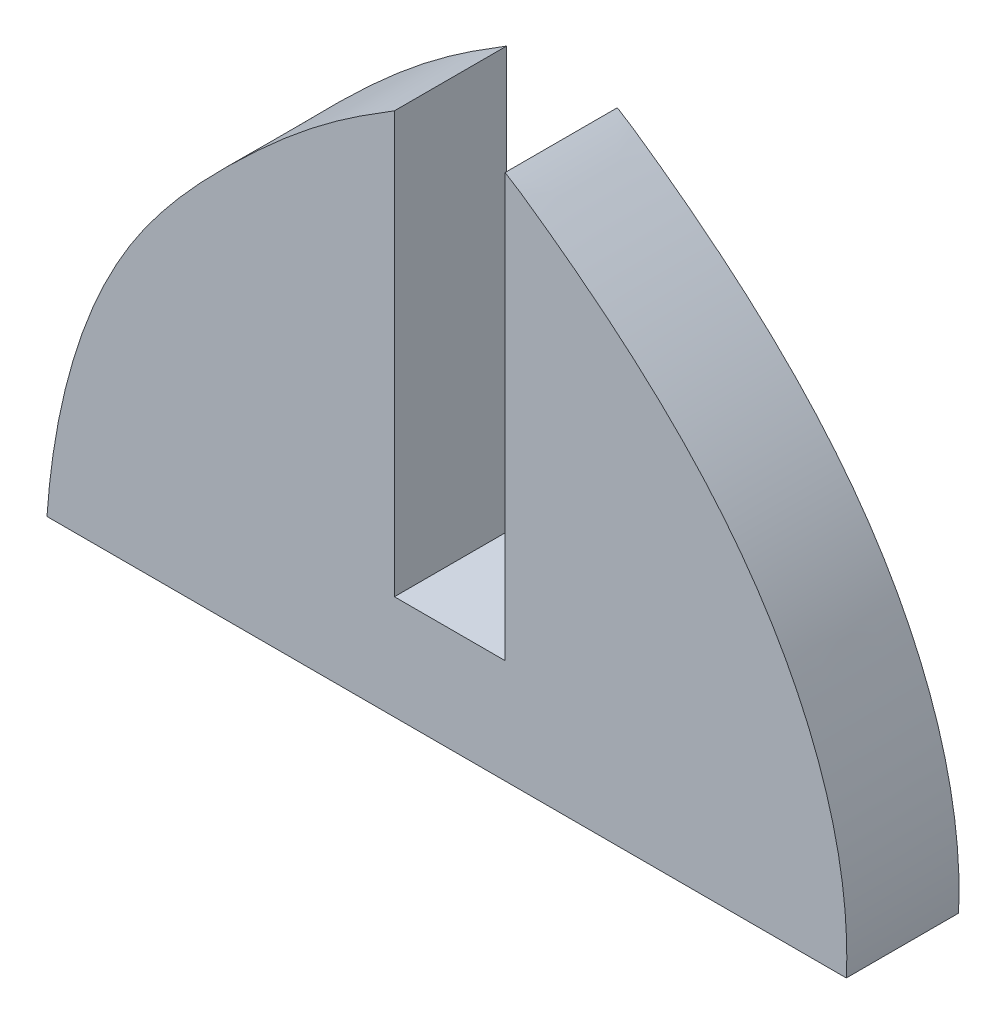
from build123d import *

# Parameters (mm, degrees)
EXTRUDE_1_DEPTH = 8


with BuildPart() as part:
    # 草图1 → 凸台-拉伸1 (new body)
    with BuildSketch(Plane.XY):
        with BuildLine():
            add(Edge.make_bspline(
                [(1205.000343889, 200.380448257), (1203.802132525, 199.644141671), (1199.659392578, 197.029571139), (1193.276793905, 191.438907576), (1183.524062882, 180.866285612), (1180.694379897, 169.80625417), (1180.232585387, 162.95060423)],
                knots=[0.038951436, 0.038951436, 0.038951436, 0.038951436, 0.125740292, 0.329523156, 0.570718558, 1, 1, 1, 1], degree=3))
            Line((1180.232585387, 162.95060423), (1237.211883134, 162.95060423))
            add(Edge.make_bspline(
                [(1212.88866118, 200.514821588), (1213.591796404, 200.102674546), (1216.322248426, 198.206599205), (1221.914919676, 193.964391888), (1232.595967144, 183.625439508), (1237.637966356, 171.491478384), (1237.211883134, 162.95060423)],
                knots=[0.038390069, 0.038390069, 0.038390069, 0.038390069, 0.088763706, 0.237953219, 0.477618195, 1, 1, 1, 1], degree=3))
            Line((1212.88866118, 200.514821588), (1212.88866118, 170.380448257))
            Line((1212.88866118, 170.380448257), (1205.000343889, 170.380448257))
            Line((1205.000343889, 170.380448257), (1205.000343889, 171.705389916))
            Line((1205.000343889, 171.705389916), (1205.000343889, 200.380448257))
        make_face()
    extrude(amount=EXTRUDE_1_DEPTH)


solid = part.part
